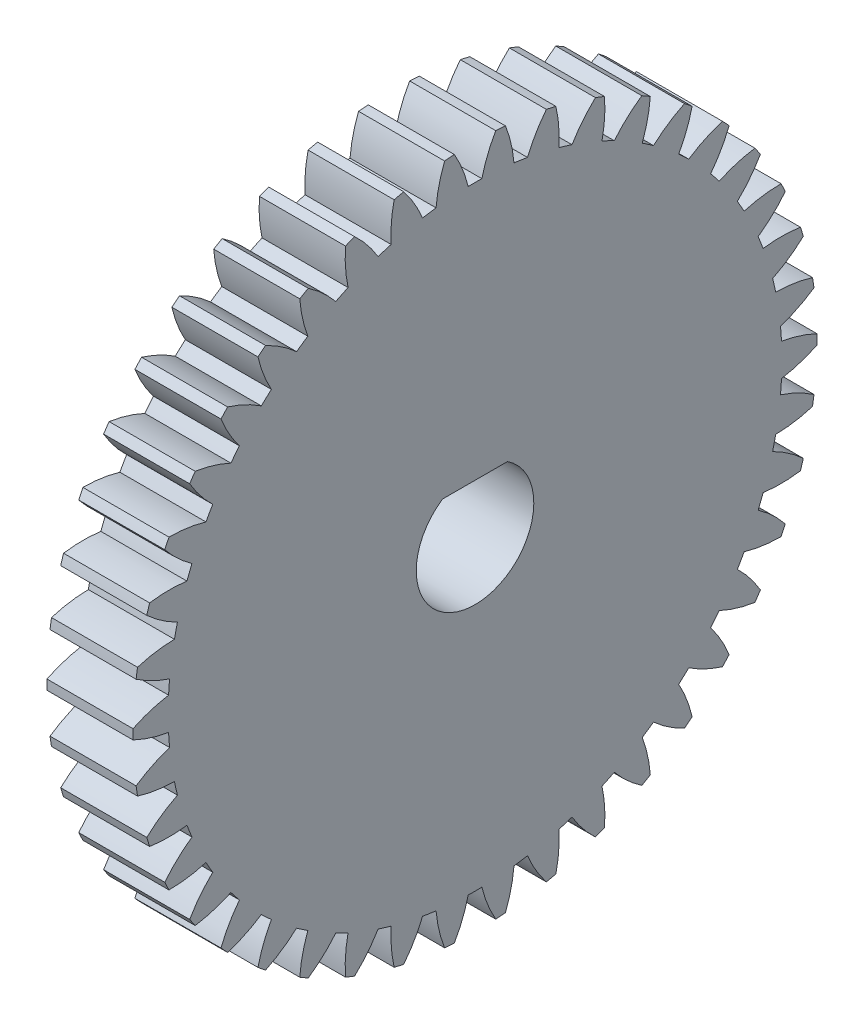
from build123d import *

# Parameters (mm, degrees)
BASPROSKE_W        = 4.3942
BASPROSKE_H        = 17.4625
TOOTHCUT_DEPTH     = 26.083596356
TEETHCUTS_COUNT    = 42
TEETHCUTS_ANGLE    = 351.428571429
BORSKE_R           = 0.396875
BORE_DEPTH         = 50.8000508
CUT_EXTRUDE1_DEPTH = 7.366


with BuildPart() as part:
    # BasProSke → Base-Revolve (revolve)
    with BuildSketch(Plane(origin=(0, 0, 0), x_dir=(1, 0, 0), z_dir=(0, 1, 0))):
        with Locations((2.1971, 8.73125)):
            Rectangle(BASPROSKE_W, BASPROSKE_H)
    revolve(axis=Axis((-10, 0, 0), (1, 0, 0)))

    # TooCutSke → ToothCut (cut, through all)
    with BuildSketch(Plane(origin=(0, 0, 0), x_dir=(0, 0, -1), z_dir=(1, 0, 0))):
        with BuildLine():
            ThreePointArc((0.348764079, 15.661567205), (0, 15.66545), (-0.348764079, 15.661567205))
            ThreePointArc((-0.348764079, 15.661567205), (-0.644200617, 16.584632497), (-1.070338344, 17.455114501))
            ThreePointArc((-1.070338344, 17.455114501), (0, 17.4879), (1.070338344, 17.455114501))
            ThreePointArc((1.070338344, 17.455114501), (0.644200617, 16.584632497), (0.348764079, 15.661567205))
        make_face()
    toothcut = extrude(amount=TOOTHCUT_DEPTH, mode=Mode.SUBTRACT)

    # TeethCuts: ToothCut ×42 about axis
    teethcuts_axis = Axis((-10, 0, 0), (1, 0, 0))
    for i in range(1, TEETHCUTS_COUNT):
        add(toothcut.rotate(teethcuts_axis, i * TEETHCUTS_ANGLE / (TEETHCUTS_COUNT - 1)), mode=Mode.SUBTRACT)

    # BorSke → Bore (cut, symmetric)
    with BuildSketch(Plane(origin=(0, 0, 0), x_dir=(0, 0, -1), z_dir=(1, 0, 0))):
        Circle(BORSKE_R)
    extrude(amount=BORE_DEPTH, both=True, mode=Mode.SUBTRACT)

    # Sketch1 → Cut-Extrude1 (cut)
    with BuildSketch(Plane(origin=(4.3942, 0, 0), x_dir=(0, 0, -1), z_dir=(1, 0, 0))):
        with BuildLine():
            Line((-1.658312395, 2.5), (1.658312395, 2.5))
            ThreePointArc((1.658312395, 2.5), (0, -3), (-1.658312395, 2.5))
        make_face()
    extrude(amount=-CUT_EXTRUDE1_DEPTH, mode=Mode.SUBTRACT)


solid = part.part
